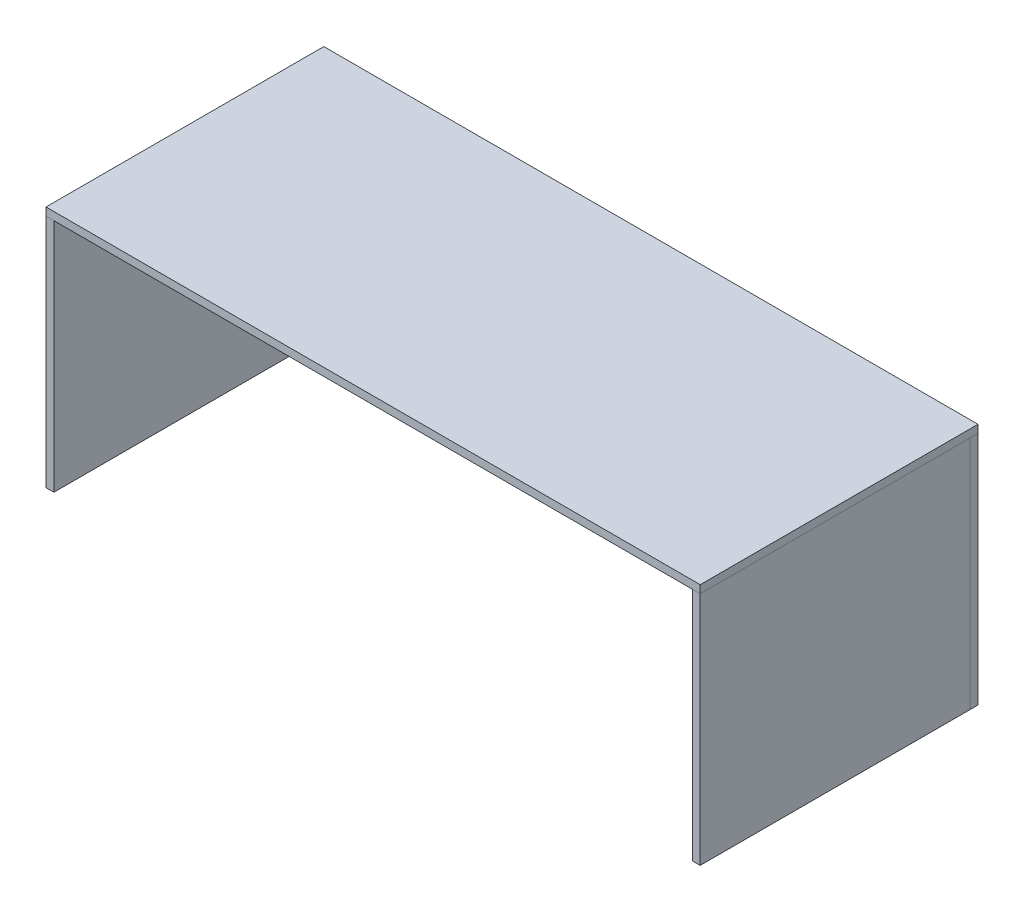
from build123d import *

# Parameters (mm, degrees)
SKETCH1_W           = 463.55
SKETCH1_H           = 166.6875
BOSS_EXTRUDE1_DEPTH = 5.588
SKETCH3_W           = 463.55
SKETCH3_H           = 196.85
BOSS_EXTRUDE2_DEPTH = 5.588
SKETCH5_W           = 191.262
SKETCH5_H           = 166.6875
BOSS_EXTRUDE3_DEPTH = 5.588
SKETCH8_W           = 191.262
SKETCH8_H           = 166.6875
BOSS_EXTRUDE6_DEPTH = 5.588


with BuildPart() as part:
    # Sketch1 → Boss-Extrude1 (new body)
    with BuildSketch(Plane.XY):
        Rectangle(SKETCH1_W, SKETCH1_H)
    extrude(amount=BOSS_EXTRUDE1_DEPTH)


with BuildPart() as body_2:
    # Sketch3 → Boss-Extrude2 (new body)
    with BuildSketch(Plane(origin=(0, 83.34375, 0), x_dir=(1, 0, 0), z_dir=(0, 1, 0))):
        with Locations((0, -98.425)):
            Rectangle(SKETCH3_W, SKETCH3_H)
    extrude(amount=BOSS_EXTRUDE2_DEPTH)


with BuildPart() as body_3:
    # Sketch5 → Boss-Extrude3 (new body)
    with BuildSketch(Plane(origin=(231.775, 0, 0), x_dir=(0, 0, -1), z_dir=(1, 0, 0))):
        with Locations((-101.219, 0)):
            Rectangle(SKETCH5_W, SKETCH5_H)
    extrude(amount=-BOSS_EXTRUDE3_DEPTH)


with BuildPart() as body_4:
    # Sketch8 → Boss-Extrude6 (new body)
    with BuildSketch(Plane.ZY.offset(231.775)):
        with Locations((101.219, 0)):
            Rectangle(SKETCH8_W, SKETCH8_H)
    extrude(amount=-BOSS_EXTRUDE6_DEPTH)


solid = Compound([part.part, body_2.part, body_3.part, body_4.part])
